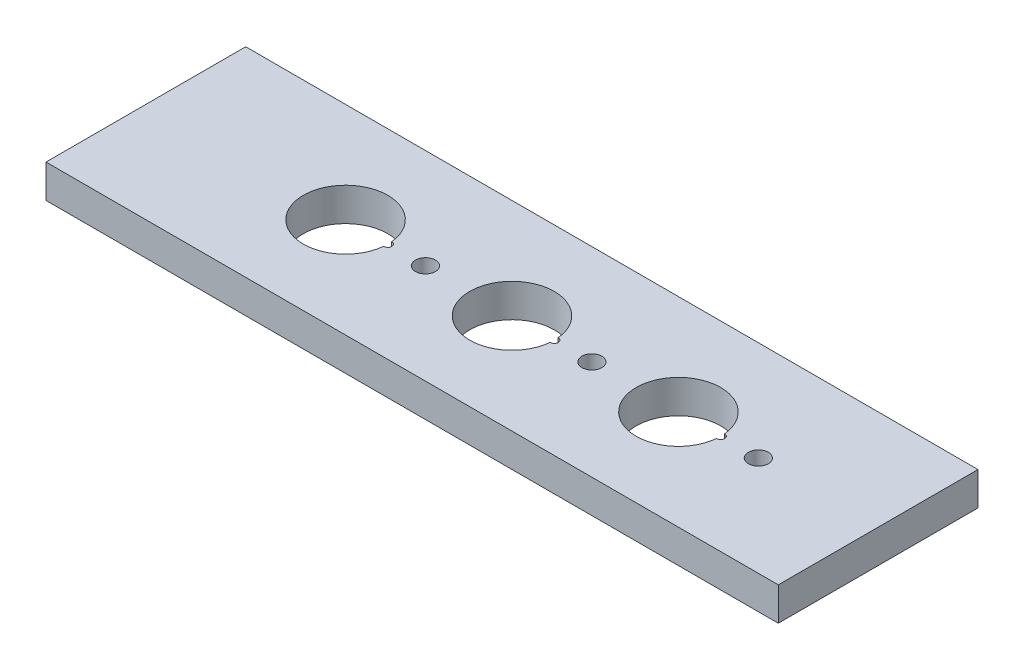
from build123d import *

# Parameters (mm, degrees)
SKETCH1_W           = 110
SKETCH1_H           = 30
SKETCH1_R           = 1.5
BOSS_EXTRUDE1_DEPTH = 5


with BuildPart() as part:
    # Sketch1 → Boss-Extrude1 (new body)
    with BuildSketch(Plane(origin=(0, 0, 0), x_dir=(1, 0, 0), z_dir=(0, 1, 0))):
        Rectangle(SKETCH1_W, SKETCH1_H)
        with Locations((37, 0)):
            Circle(SKETCH1_R, mode=Mode.SUBTRACT)
        with Locations((12, 0)):
            Circle(SKETCH1_R, mode=Mode.SUBTRACT)
        with Locations((-13, 0)):
            Circle(SKETCH1_R, mode=Mode.SUBTRACT)
        with BuildLine():
            ThreePointArc((31.321653543, 0.599330025), (31.95, 0), (31.321653543, -0.599330025))
            ThreePointArc((31.321653543, -0.599330025), (18.65, 0), (31.321653543, 0.599330025))
        make_face(mode=Mode.SUBTRACT)
        with BuildLine():
            ThreePointArc((6.321653543, 0.599330025), (6.95, 0), (6.321653543, -0.599330025))
            ThreePointArc((6.321653543, -0.599330025), (-6.35, 0), (6.321653543, 0.599330025))
        make_face(mode=Mode.SUBTRACT)
        with BuildLine():
            ThreePointArc((-18.678346457, 0.599330025), (-18.05, 0), (-18.678346457, -0.599330025))
            ThreePointArc((-18.678346457, -0.599330025), (-31.35, 0), (-18.678346457, 0.599330025))
        make_face(mode=Mode.SUBTRACT)
    extrude(amount=BOSS_EXTRUDE1_DEPTH)


solid = part.part
